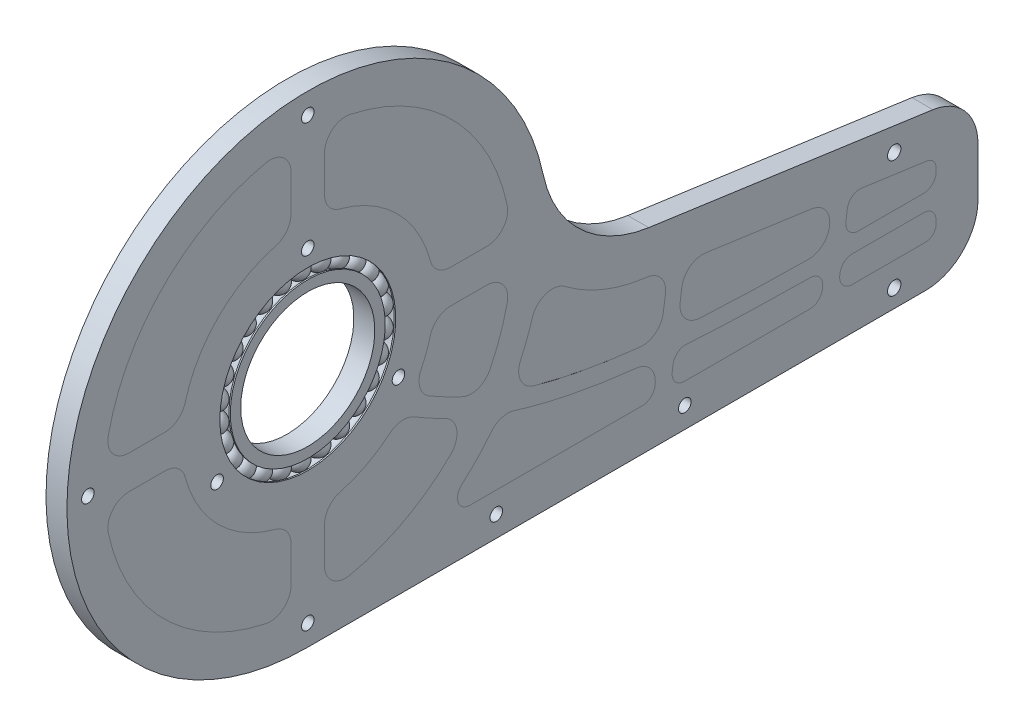
from build123d import *
from OCP.BRepFilletAPI import BRepFilletAPI_MakeFillet

# Parameters (mm, degrees)
SKETCH1_R           = 23.5
SKETCH1_R_2         = 1.5
BOSS_EXTRUDE1_DEPTH = 5
CUT_EXTRUDE1_DEPTH  = 171.091886932
FILLET1_R1          = 5
FILLET1_R2          = 3
BOSS_EXTRUDE2_DEPTH = 5
SKETCH7_R           = 1.6
CUT_EXTRUDE2_DEPTH  = 171.091887063
CIRPATTERN1_COUNT   = 26
SKETCH10_R          = 1.5
CUT_EXTRUDE3_DEPTH  = 171.091887063


# Read off the part's stored shape, not the designer's step: Boss-Extrude2
with BuildPart() as part:
    # Sketch1 → Boss-Extrude1 (new body)
    with BuildSketch(Plane(origin=(0, 0, 0), x_dir=(0, 0, -1), z_dir=(1, 0, 0))):
        with BuildLine():
            Line((0, -57.5), (147.5, -57.5))
            ThreePointArc((147.5, -57.5), (156.338834765, -53.838834765), (160, -45))
            Line((160, -45), (160, -33.365178619))
            ThreePointArc((160, -33.365178619), (156.934208165, -25.164830072), (149.240685392, -20.986971383))
            Line((149.240685392, -20.986971383), (81.395536862, -11.446247371))
            ThreePointArc((81.395536862, -11.446247371), (65.121194516, -3.68658445), (56.233805186, 12.000381425))
            ThreePointArc((56.233805186, 12.000381425), (-44.700514158, 36.16785913), (0, -57.5))
        make_face()
        Circle(SKETCH1_R, mode=Mode.SUBTRACT)
        with Locations((0, 52.5)):
            Circle(SKETCH1_R_2, mode=Mode.SUBTRACT)
        with Locations((-52.5, 0)):
            Circle(SKETCH1_R_2, mode=Mode.SUBTRACT)
        with Locations((0, -52.5)):
            Circle(SKETCH1_R_2, mode=Mode.SUBTRACT)
        with Locations((45, -52.5)):
            Circle(SKETCH1_R_2, mode=Mode.SUBTRACT)
        with Locations((90, -52.5)):
            Circle(SKETCH1_R_2, mode=Mode.SUBTRACT)
    extrude(amount=BOSS_EXTRUDE1_DEPTH)

    # Sketch2 → Cut-Extrude1 (cut, through all)
    with BuildSketch(Plane(origin=(5, 0, 0), x_dir=(0, 0, -1), z_dir=(1, 0, 0))):
        with BuildLine():
            ThreePointArc((22.185246346, -20.586763819), (13.912908948, -26.878075909), (4, -30))
            Line((4, -30), (4, -48.5))
            ThreePointArc((4, -48.5), (23.432821368, -42.651528492), (38.790670249, -29.385947349))
            add(Edge.make_bspline(
                [(38.790670249, -29.385947349), (38.208277868, -29.138826897), (37.04735221, -28.634254689), (33.613250417, -27.069615417), (29.274833218, -24.860974129), (24.928400153, -22.320548454), (22.810244388, -20.988202917), (22.185246346, -20.586763819)],
                knots=[0.667204069, 0.667204069, 0.667204069, 0.667204069, 0.681111736, 0.695019404, 0.75, 0.787250705, 0.802875705, 0.802875705, 0.802875705, 0.802875705], degree=3))
        make_face()
        with BuildLine():
            add(Edge.make_bspline(
                [(41.120637072, -26.025818082), (40.546652129, -25.787609064), (39.402827933, -25.301001665), (35.833175383, -23.706675572), (31.540190896, -21.541218104), (27.246972835, -19.043482716), (25.325200598, -17.84518612), (24.721080246, -17.460475122)],
                knots=[0.660871723, 0.660871723, 0.660871723, 0.660871723, 0.675055768, 0.689239813, 0.75, 0.784024564, 0.799649564, 0.799649564, 0.799649564, 0.799649564], degree=3))
            ThreePointArc((41.120637072, -26.025818082), (46.143784119, -15.45966323), (48.5, -4))
            Line((48.5, -4), (30, -4))
            ThreePointArc((30, -4), (28.176146888, -11.050101654), (24.721080246, -17.460475122))
        make_face()
        with BuildLine():
            Line((30, 4), (48.201922205, 4))
            Line((48.201922205, 4), (48.5, 4))
            ThreePointArc((48.5, 4), (34.41111739, 34.41111739), (4, 48.5))
            Line((4, 48.5), (4, 30))
            ThreePointArc((4, 30), (21.400934559, 21.400934559), (30, 4))
        make_face()
        with BuildLine():
            ThreePointArc((45.879697443, -32.11001966), (38.546027668, -40.622699947), (29.6605799, -47.5))
            Line((29.6605799, -47.5), (82.519678579, -47.5))
            Line((82.519678579, -47.5), (83.638752831, -39.542138653))
            add(Edge.make_bspline(
                [(83.638752831, -39.542138653), (82.136627814, -39.407732053), (74.115556507, -38.620412405), (61.898724071, -36.757253444), (51.310285462, -33.943549975), (46.479451728, -32.317463696), (45.879697443, -32.11001966)],
                knots=[0.346672188, 0.346672188, 0.346672188, 0.346672188, 0.375, 0.5, 0.597665733, 0.6115734, 0.6115734, 0.6115734, 0.6115734], degree=3))
        make_face()
        with BuildLine():
            Line((87.5930026, -39.867473629), (86.519678579, -47.5))
            Line((86.519678579, -47.5), (122.480321421, -47.5))
            Line((122.480321421, -47.5), (123.379214774, -41.107869489))
            add(Edge.make_bspline(
                [(123.379214774, -41.107869489), (123.309909416, -41.107243691), (119.069012377, -41.068607323), (110.949562787, -40.952647021), (99.651727414, -40.60714539), (92.047864376, -40.193028013), (88.114578612, -39.906787388), (87.5930026, -39.867473629)],
                knots=[0.123962248, 0.123962248, 0.123962248, 0.123962248, 0.125, 0.1875, 0.25, 0.3125, 0.322106441, 0.322106441, 0.322106441, 0.322106441], degree=3))
        make_face()
        with BuildLine():
            add(Edge.make_bspline(
                [(84.196491813, -35.575994784), (82.647837316, -35.438625592), (74.684695363, -34.660281607), (63.048861545, -32.88222555), (53.085222246, -30.275299461), (48.711109914, -28.846362296), (48.118024667, -28.647088894)],
                knots=[0.345388461, 0.345388461, 0.345388461, 0.345388461, 0.375, 0.5, 0.589951496, 0.604135542, 0.604135542, 0.604135542, 0.604135542], degree=3))
            Line((84.196491813, -35.575994784), (86.077071858, -22.202981125))
            Line((86.077071858, -22.202981125), (80.002988548, -21.34881316))
            ThreePointArc((80.002988548, -21.34881316), (66.51040029, -16.904021152), (55.422178193, -8.023849723))
            ThreePointArc((55.422178193, -8.023849723), (52.787052395, -18.695643863), (48.118024667, -28.647088894))
        make_face()
        with BuildLine():
            Line((89.999504226, -22.754573177), (88.151196988, -35.898091313))
            add(Edge.make_bspline(
                [(123.94103929, -37.112672931), (123.696247868, -37.110561437), (119.287195408, -37.071300928), (111.033523944, -36.953360628), (99.8147399, -36.610105812), (92.380317535, -36.205001573), (88.580803362, -35.930099221), (88.151196988, -35.898091313)],
                knots=[0.121334068, 0.121334068, 0.121334068, 0.121334068, 0.125, 0.1875, 0.25, 0.3125, 0.320505317, 0.320505317, 0.320505317, 0.320505317], degree=3))
            Line((123.94103929, -37.112672931), (125.262801588, -27.713474368))
            Line((125.262801588, -27.713474368), (89.999504226, -22.754573177))
        make_face()
        with BuildLine():
            Line((127.414275447, -41.138422271), (126.519678579, -47.5))
            Line((126.519678579, -47.5), (147.5, -47.5))
            ThreePointArc((147.5, -47.5), (149.267766953, -46.767766953), (150, -45))
            Line((150, -45), (150, -41.182589309))
            add(Edge.make_bspline(
                [(150, -41.182589309), (148.812824417, -41.182589309), (146.423466184, -41.182589324), (141.76480628, -41.181393352), (136.080016811, -41.17541248), (130.968491752, -41.158687842), (128.116800073, -41.142792862), (127.414275447, -41.138422271)],
                knots=[0, 0, 0, 0, 0.015625, 0.03125, 0.0625, 0.09375, 0.104041802, 0.104041802, 0.104041802, 0.104041802], degree=3))
        make_face()
        with BuildLine():
            Line((129.223827903, -28.270493694), (127.976307043, -37.141753144))
            add(Edge.make_bspline(
                [(150, -37.182589309), (148.812993791, -37.182589309), (146.423722347, -37.182589295), (141.767251686, -37.181393752), (136.087757115, -37.175417046), (131.169092842, -37.159320148), (128.499860489, -37.144838913), (127.976307043, -37.141753144)],
                knots=[0, 0, 0, 0, 0.015625, 0.03125, 0.0625, 0.09375, 0.101416179, 0.101416179, 0.101416179, 0.101416179], degree=3))
            Line((150, -37.182589309), (150, -33.365178619))
            ThreePointArc((150, -33.365178619), (149.386841633, -31.725108909), (147.848137078, -30.889537172))
            Line((147.848137078, -30.889537172), (129.223827903, -28.270493694))
        make_face()
        with BuildLine():
            ThreePointArc((-4, -30), (-21.400934559, -21.400934559), (-30, -4))
            Line((-30, -4), (-48.5, -4))
            ThreePointArc((-48.5, -4), (-34.41111739, -34.41111739), (-4, -48.5))
            Line((-4, -48.5), (-4, -30))
        make_face()
        with BuildLine():
            ThreePointArc((-30, 4), (-21.400934559, 21.400934559), (-4, 30))
            Line((-4, 30), (-4, 48.5))
            ThreePointArc((-4, 48.5), (-34.41111739, 34.41111739), (-48.5, 4))
            Line((-48.5, 4), (-30, 4))
        make_face()
    extrude(amount=-CUT_EXTRUDE1_DEPTH, mode=Mode.SUBTRACT)

    # Fillet1: one fillet with a radius per group of edges: ONE call of the kernel's fillet builder (fillet() takes one radius for all edges)
    fillet1_edges_1 = [part.edges().sort_by_distance(p)[0] for p in [
        (2.5, 48.5, 4),
        (2.5, 4, 48.5),
        (2.5, 4, 30),
        (2.5, 30, 4),
        (2.5, 48.5, -4),
        (2.5, 30, -4),
        (2.5, 4, -48.5),
        (2.5, 4, -30),
        (2.5, -4, -30),
        (2.5, -4, -48.5),
        (2.5, -4, 48.5),
        (2.5, -4, 30),
        (2.5, -30, 4),
        (2.5, -29.385947349, -38.790670249),
        (2.5, -20.586763819, -22.185246346),
        (2.5, -48.5, -4),
        (2.5, -48.5, 4),
        (2.5, -32.11001966, -45.879697443),
        (2.5, -8.023849723, -55.422178193),
        (2.5, -22.202981125, -86.077071858),
        (2.5, -28.647088894, -48.118024667),
        (2.5, -35.575994784, -84.196491813),
        (2.5, -35.898091313, -88.151196988),
        (2.5, -27.713474368, -125.262801588),
        (2.5, -37.112672931, -123.94103929),
        (2.5, -22.754573177, -89.999504226),
        (2.5, -39.542138653, -83.638752831),
        (2.5, -30, -4),
        (2.5, -17.460475122, -24.721080246),
        (2.5, -26.025818082, -41.120637072),
    ]]
    fillet1_edges_2 = [part.edges().sort_by_distance(p)[0] for p in [
        (2.5, -47.5, -29.6605799),
        (2.5, -47.5, -82.519678579),
        (2.5, -39.867473629, -87.5930026),
        (2.5, -47.5, -86.519678579),
        (2.5, -41.107869489, -123.379214774),
        (2.5, -47.5, -122.480321421),
        (2.5, -41.138422271, -127.414275447),
        (2.5, -47.5, -126.519678579),
        (2.5, -28.270493694, -129.223827903),
        (2.5, -37.141753144, -127.976307043),
        (2.5, -37.182589309, -150),
        (2.5, -41.182589309, -150),
    ]]
    fillet1 = BRepFilletAPI_MakeFillet(part.part.solid().wrapped)
    for e in fillet1_edges_1:
        fillet1.Add(FILLET1_R1, e.wrapped)
    for e in fillet1_edges_2:
        fillet1.Add(FILLET1_R2, e.wrapped)
    add(Compound.cast(fillet1.Shape()), mode=Mode.REPLACE)

    # Sketch7 → Cut-Extrude2 (cut, through all)
    with BuildSketch(Plane(origin=(5, 0, 0), x_dir=(0, 0, -1), z_dir=(1, 0, 0))):
        with Locations((140, -25.182589309)):
            Circle(SKETCH7_R)
        with Locations(Location((140, -53.182589309, 0), (0, 0, 180))):
            Circle(SKETCH7_R)
    extrude(amount=-CUT_EXTRUDE2_DEPTH, mode=Mode.SUBTRACT)

    # Sketch4 → Revolve3 (revolve)
    with BuildSketch(Plane.XY, mode=Mode.PRIVATE) as revolve3_sk:
        with BuildLine():
            ThreePointArc((0.334936491, 18.5), (2.5, 17.25), (4.665063509, 18.5))
            Line((4.665063509, 18.5), (5, 18.5))
            Line((5, 18.5), (5, 16))
            Line((5, 16), (0, 16))
            Line((0, 16), (0, 18.5))
            Line((0, 18.5), (0.334936491, 18.5))
        make_face()
        with BuildLine():
            ThreePointArc((4.665063509, 21), (2.5, 22.25), (0.334936491, 21))
            Line((0.334936491, 21), (0, 21))
            Line((0, 21), (0, 23.5))
            Line((0, 23.5), (5, 23.5))
            Line((5, 23.5), (5, 21))
            Line((5, 21), (4.665063509, 21))
        make_face()
    revolve(revolve3_sk.sketch.rotate(Axis((0, 0, 0), (1, 0, 0)), 90), axis=Axis((0, 0, 0), (1, 0, 0)))


with BuildPart() as body_2:
    # Boss-Extrude2 outline → Boss-Extrude2 (new body)
    with BuildSketch(Plane(origin=(0, 0, 0), x_dir=(0, 0, -1), z_dir=(1, 0, 0))):
        with BuildLine():
            ThreePointArc((127.000301711, -44.082235506), (127.706861488, -46.468083651), (129.971071448, -47.5))
            Line((129.971071448, -47.5), (147.5, -47.5))
            ThreePointArc((147.5, -47.5), (149.267766953, -46.767766953), (150, -45))
            Line((150, -45), (150, -44.182500207))
            ThreePointArc((150, -44.182500207), (149.121415194, -42.061274718), (147.000268283, -41.182500219))
            add(Edge.make_bspline(
                [(147.000268283, -41.182500219), (146.812686203, -41.182483444), (145.443341439, -41.182337706), (141.76480628, -41.181393352), (136.255555018, -41.175597161), (132.030232477, -41.162146761), (130.034095757, -41.152710267)],
                knots=[0.013149231, 0.013149231, 0.013149231, 0.013149231, 0.015625, 0.03125, 0.0625, 0.091337611, 0.091337611, 0.091337611, 0.091337611], degree=3))
            ThreePointArc((130.034095757, -41.152710267), (128.057187471, -41.883821212), (127.049144044, -43.734912251))
            Line((127.049144044, -43.734912251), (127.000301711, -44.082235506))
        make_face()
        with BuildLine():
            Line((89.971071448, -47.5), (119.872678552, -47.5))
            ThreePointArc((119.872678552, -47.5), (121.840762204, -46.76420996), (122.843448289, -44.917764494))
            Line((122.843448289, -44.917764494), (122.903627951, -44.489820231))
            ThreePointArc((122.903627951, -44.489820231), (122.208769003, -42.117514849), (119.968652158, -41.072269279))
            add(Edge.make_bspline(
                [(119.968652158, -41.072269279), (116.930598371, -41.036018723), (109.976696211, -40.922895571), (100.092777534, -40.620633242), (93.419117385, -40.267091683), (90.372954412, -40.064496339)],
                knots=[0.14114579, 0.14114579, 0.14114579, 0.14114579, 0.1875, 0.25, 0.305180288, 0.305180288, 0.305180288, 0.305180288], degree=3))
            ThreePointArc((90.372954412, -40.064496339), (88.282040284, -40.729582629), (87.203099383, -42.64011873))
            Line((87.203099383, -42.64011873), (87.000301711, -44.082235506))
            ThreePointArc((87.000301711, -44.082235506), (87.706861488, -46.468083651), (89.971071448, -47.5))
        make_face()
        with BuildLine():
            Line((38.73951471, -47.5), (79.91203571, -47.5))
            ThreePointArc((79.91203571, -47.5), (81.880119362, -46.76420996), (82.882805447, -44.917764494))
            Line((82.882805447, -44.917764494), (82.913898967, -44.696655021))
            ThreePointArc((82.913898967, -44.696655021), (81.911175874, -40.932991828), (78.51236968, -39.030695665))
            add(Edge.make_bspline(
                [(78.51236968, -39.030695665), (72.309256976, -38.344498563), (62.27249356, -36.793159127), (52.985980437, -34.385427724), (49.222984389, -33.209816183)],
                knots=[0.379394701, 0.379394701, 0.379394701, 0.379394701, 0.5, 0.585926939, 0.585926939, 0.585926939, 0.585926939], degree=3))
            ThreePointArc((49.222984389, -33.209816183), (46.264295939, -33.202595877), (43.819526871, -34.869027299))
            ThreePointArc((43.819526871, -34.869027299), (40.46268709, -38.713963287), (36.769708878, -42.237288136))
            ThreePointArc((36.769708878, -42.237288136), (35.929876336, -45.551633112), (38.73951471, -47.5))
        make_face()
        with BuildLine():
            Line((150, -34.182500163), (150, -33.365178619))
            ThreePointArc((150, -33.365178619), (149.386841633, -31.725108909), (147.848137078, -30.889537172))
            Line((147.848137078, -30.889537172), (132.19459764, -28.688258188))
            ThreePointArc((132.19459764, -28.688258188), (129.971585827, -29.262972392), (128.806063409, -31.24126343))
            Line((128.806063409, -31.24126343), (128.454541654, -33.74097369))
            ThreePointArc((128.454541654, -33.74097369), (129.157125744, -36.122238598), (131.413176817, -37.158713643))
            add(Edge.make_bspline(
                [(131.413176817, -37.158713643), (132.964881549, -37.164990119), (136.738536803, -37.176101881), (141.767251686, -37.181393752), (145.443755956, -37.18233769), (146.812493402, -37.182483398), (146.999731573, -37.182500151)],
                knots=[0.013153288, 0.013153288, 0.013153288, 0.013153288, 0.035451406, 0.066701406, 0.082326406, 0.084798118, 0.084798118, 0.084798118, 0.084798118], degree=3))
            ThreePointArc((146.999731573, -37.182500151), (149.121225438, -36.303915408), (150, -34.182500163))
        make_face()
        with BuildLine():
            Line((124.552654082, -32.763412189), (124.566527431, -32.664757263))
            ThreePointArc((124.566527431, -32.664757263), (123.608670425, -28.959737573), (120.311518694, -27.017200211))
            Line((120.311518694, -27.017200211), (94.95078712, -23.450847334))
            ThreePointArc((94.95078712, -23.450847334), (91.245767431, -24.40870434), (89.303230069, -27.705856071))
            Line((89.303230069, -27.705856071), (88.900856811, -30.567177017))
            ThreePointArc((88.900856811, -30.567177017), (89.985118561, -34.433016992), (93.562888485, -36.255077535))
            add(Edge.make_bspline(
                [(93.562888485, -36.255077535), (95.645334652, -36.375749647), (101.312204101, -36.655922881), (109.9215952, -36.91933957), (116.679734901, -37.031346079), (119.539466767, -37.066754802)],
                knots=[0.143583711, 0.143583711, 0.143583711, 0.143583711, 0.18105653, 0.24355653, 0.287472819, 0.287472819, 0.287472819, 0.287472819], degree=3))
            ThreePointArc((119.539466767, -37.066754802), (122.858086538, -35.86105489), (124.552654082, -32.763412189))
        make_face()
        with BuildLine():
            Line((81.125788964, -21.506706968), (80.002988548, -21.34881316))
            ThreePointArc((80.002988548, -21.34881316), (70.218668397, -18.674155024), (61.421707918, -13.624382426))
            ThreePointArc((61.421707918, -13.624382426), (56.854417413, -12.85589305), (53.615661085, -16.166659718))
            ThreePointArc((53.615661085, -16.166659718), (52.345035582, -19.899679643), (50.814856037, -23.534026557))
            ThreePointArc((50.814856037, -23.534026557), (50.813374255, -27.733328861), (54.013210489, -30.452738745))
            add(Edge.make_bspline(
                [(54.013210489, -30.452738745), (56.511617504, -31.147001548), (64.503556907, -33.097971644), (73.121226203, -34.421311833), (79.372600536, -35.101053847)],
                knots=[0.376625329, 0.376625329, 0.376625329, 0.376625329, 0.43449557, 0.557870241, 0.557870241, 0.557870241, 0.557870241], degree=3))
            ThreePointArc((79.372600536, -35.101053847), (82.98415693, -34.076051454), (84.864371713, -30.826626603))
            Line((84.864371713, -30.826626603), (85.380797701, -27.154264019))
            ThreePointArc((85.380797701, -27.154264019), (84.422940695, -23.44924433), (81.125788964, -21.506706968))
        make_face()
        with BuildLine():
            ThreePointArc((-47.61971687, -10.0305815), (-34.41111739, -34.41111739), (-10.0305815, -47.61971687))
            ThreePointArc((-10.0305815, -47.61971687), (-5.849833933, -46.609920301), (-4, -42.727079363))
            Line((-4, -42.727079363), (-4, -34.097726009))
            ThreePointArc((-4, -34.097726009), (-5.038928508, -31.046511064), (-7.723965056, -29.263293797))
            ThreePointArc((-7.723965056, -29.263293797), (-21.400934559, -21.400934559), (-29.263293797, -7.723965056))
            ThreePointArc((-29.263293797, -7.723965056), (-31.046511064, -5.038928508), (-34.097726009, -4))
            Line((-34.097726009, -4), (-42.727079363, -4))
            ThreePointArc((-42.727079363, -4), (-46.609920301, -5.849833933), (-47.61971687, -10.0305815))
        make_face()
        with BuildLine():
            ThreePointArc((10.0305815, -47.61971687), (23.006224156, -42.883139461), (34.128327556, -34.691602129))
            ThreePointArc((34.128327556, -34.691602129), (35.559721465, -30.341494752), (32.848768838, -26.650551976))
            add(Edge.make_bspline(
                [(32.848768838, -26.650551976), (31.413241176, -25.936452988), (28.92150774, -24.62767543), (26.453145204, -23.207625264), (25.400791824, -22.579226637)],
                knots=[0.715007628, 0.715007628, 0.715007628, 0.715007628, 0.75, 0.776154556, 0.776154556, 0.776154556, 0.776154556], degree=3))
            ThreePointArc((25.400791824, -22.579226637), (22.422590157, -21.889337831), (19.599438982, -23.062133284))
            ThreePointArc((19.599438982, -23.062133284), (14.009129165, -26.828050619), (7.723965056, -29.263293797))
            ThreePointArc((7.723965056, -29.263293797), (5.038928508, -31.046511064), (4, -34.097726009))
            Line((4, -34.097726009), (4, -42.727079363))
            ThreePointArc((4, -42.727079363), (5.849833933, -46.609920301), (10.0305815, -47.61971687))
        make_face()
        with BuildLine():
            ThreePointArc((43.470458548, -21.876225306), (45.928584059, -16.087733411), (47.61971687, -10.0305815))
            ThreePointArc((47.61971687, -10.0305815), (46.609920301, -5.849833933), (42.727079363, -4))
            Line((42.727079363, -4), (34.097726009, -4))
            ThreePointArc((34.097726009, -4), (31.046511064, -5.038928508), (29.263293797, -7.723965056))
            ThreePointArc((29.263293797, -7.723965056), (28.319488967, -10.67738473), (27.078470008, -13.51874484))
            ThreePointArc((27.078470008, -13.51874484), (26.765470141, -17.197622518), (29.062468052, -20.088281696))
            add(Edge.make_bspline(
                [(29.062468052, -20.088281696), (29.543171425, -20.364263669), (32.128533422, -21.8221752), (34.737633759, -23.15259074), (36.885206954, -24.157389595)],
                knots=[0.696055038, 0.696055038, 0.696055038, 0.696055038, 0.708398801, 0.762343763, 0.762343763, 0.762343763, 0.762343763], degree=3))
            ThreePointArc((36.885206954, -24.157389595), (40.640744743, -24.353139054), (43.470458548, -21.876225306))
        make_face()
        with BuildLine():
            ThreePointArc((47.61971687, 10.0305815), (34.41111739, 34.41111739), (10.0305815, 47.61971687))
            ThreePointArc((10.0305815, 47.61971687), (5.849833933, 46.609920301), (4, 42.727079363))
            Line((4, 42.727079363), (4, 34.097726009))
            ThreePointArc((4, 34.097726009), (5.038928508, 31.046511064), (7.723965056, 29.263293797))
            ThreePointArc((7.723965056, 29.263293797), (21.400934559, 21.400934559), (29.263293797, 7.723965056))
            ThreePointArc((29.263293797, 7.723965056), (31.046511064, 5.038928508), (34.097726009, 4))
            Line((34.097726009, 4), (42.727079363, 4))
            ThreePointArc((42.727079363, 4), (46.609920301, 5.849833933), (47.61971687, 10.0305815))
        make_face()
        with BuildLine():
            ThreePointArc((-10.0305815, 47.61971687), (-34.41111739, 34.41111739), (-47.61971687, 10.0305815))
            ThreePointArc((-47.61971687, 10.0305815), (-46.609920301, 5.849833933), (-42.727079363, 4))
            Line((-42.727079363, 4), (-34.097726009, 4))
            ThreePointArc((-34.097726009, 4), (-31.046511064, 5.038928508), (-29.263293797, 7.723965056))
            ThreePointArc((-29.263293797, 7.723965056), (-21.400934559, 21.400934559), (-7.723965056, 29.263293797))
            ThreePointArc((-7.723965056, 29.263293797), (-5.038928508, 31.046511064), (-4, 34.097726009))
            Line((-4, 34.097726009), (-4, 42.727079363))
            ThreePointArc((-4, 42.727079363), (-5.849833933, 46.609920301), (-10.0305815, 47.61971687))
        make_face()
    extrude(amount=BOSS_EXTRUDE2_DEPTH)


with BuildPart() as revolve3_piece_1:
    # of the separate pieces the step leaves, piece 1, a body of its own (revolve3_pieces)
    add(part.part.solids().sort_by_distance((0, -57.5, 0))[0])

    # Sketch10 → Cut-Extrude3 (cut, through all)
    with BuildSketch(Plane(origin=(5, 0, 0), x_dir=(0, 0, -1), z_dir=(1, 0, 0))):
        with Locations((0, 25)):
            Circle(SKETCH10_R)
        with Locations((21.650635095, -12.5)):
            Circle(SKETCH10_R)
        with Locations((-21.650635095, -12.5)):
            Circle(SKETCH10_R)
    extrude(amount=-CUT_EXTRUDE3_DEPTH, mode=Mode.SUBTRACT)


with BuildPart() as revolve3_piece_2:
    # of the separate pieces the step leaves, piece 2, a body of its own (revolve3_pieces)
    add(part.part.solids().sort_by_distance((0.334936491, 0, 18.5))[0])


with BuildPart() as body_4:
    # Sketch5 → Revolve9 (revolve)
    with BuildSketch(Plane.XY):
        with BuildLine():
            Line((4.85, 19.75), (0.15, 19.75))
            ThreePointArc((0.15, 19.75), (2.5, 17.4), (4.85, 19.75))
        make_face()
    revolve(axis=Axis((2.5, 19.75, 0), (1, 0, 0)))


with BuildPart() as cirpattern1_1:
    # CirPattern1: pattern copy
    add(body_4.part.rotate(Axis((0, 0, 0), (1, 0, 0)), 1 * 360 / CIRPATTERN1_COUNT))


with BuildPart() as cirpattern1_2:
    # CirPattern1: pattern copy
    add(body_4.part.rotate(Axis((0, 0, 0), (1, 0, 0)), 2 * 360 / CIRPATTERN1_COUNT))


with BuildPart() as cirpattern1_3:
    # CirPattern1: pattern copy
    add(body_4.part.rotate(Axis((0, 0, 0), (1, 0, 0)), 3 * 360 / CIRPATTERN1_COUNT))


with BuildPart() as cirpattern1_4:
    # CirPattern1: pattern copy
    add(body_4.part.rotate(Axis((0, 0, 0), (1, 0, 0)), 4 * 360 / CIRPATTERN1_COUNT))


with BuildPart() as cirpattern1_5:
    # CirPattern1: pattern copy
    add(body_4.part.rotate(Axis((0, 0, 0), (1, 0, 0)), 5 * 360 / CIRPATTERN1_COUNT))


with BuildPart() as cirpattern1_6:
    # CirPattern1: pattern copy
    add(body_4.part.rotate(Axis((0, 0, 0), (1, 0, 0)), 6 * 360 / CIRPATTERN1_COUNT))


with BuildPart() as cirpattern1_7:
    # CirPattern1: pattern copy
    add(body_4.part.rotate(Axis((0, 0, 0), (1, 0, 0)), 7 * 360 / CIRPATTERN1_COUNT))


with BuildPart() as cirpattern1_8:
    # CirPattern1: pattern copy
    add(body_4.part.rotate(Axis((0, 0, 0), (1, 0, 0)), 8 * 360 / CIRPATTERN1_COUNT))


with BuildPart() as cirpattern1_9:
    # CirPattern1: pattern copy
    add(body_4.part.rotate(Axis((0, 0, 0), (1, 0, 0)), 9 * 360 / CIRPATTERN1_COUNT))


with BuildPart() as cirpattern1_10:
    # CirPattern1: pattern copy
    add(body_4.part.rotate(Axis((0, 0, 0), (1, 0, 0)), 10 * 360 / CIRPATTERN1_COUNT))


with BuildPart() as cirpattern1_11:
    # CirPattern1: pattern copy
    add(body_4.part.rotate(Axis((0, 0, 0), (1, 0, 0)), 11 * 360 / CIRPATTERN1_COUNT))


with BuildPart() as cirpattern1_12:
    # CirPattern1: pattern copy
    add(body_4.part.rotate(Axis((0, 0, 0), (1, 0, 0)), 12 * 360 / CIRPATTERN1_COUNT))


with BuildPart() as cirpattern1_13:
    # CirPattern1: pattern copy
    add(body_4.part.rotate(Axis((0, 0, 0), (1, 0, 0)), 13 * 360 / CIRPATTERN1_COUNT))


with BuildPart() as cirpattern1_14:
    # CirPattern1: pattern copy
    add(body_4.part.rotate(Axis((0, 0, 0), (1, 0, 0)), 14 * 360 / CIRPATTERN1_COUNT))


with BuildPart() as cirpattern1_15:
    # CirPattern1: pattern copy
    add(body_4.part.rotate(Axis((0, 0, 0), (1, 0, 0)), 15 * 360 / CIRPATTERN1_COUNT))


with BuildPart() as cirpattern1_16:
    # CirPattern1: pattern copy
    add(body_4.part.rotate(Axis((0, 0, 0), (1, 0, 0)), 16 * 360 / CIRPATTERN1_COUNT))


with BuildPart() as cirpattern1_17:
    # CirPattern1: pattern copy
    add(body_4.part.rotate(Axis((0, 0, 0), (1, 0, 0)), 17 * 360 / CIRPATTERN1_COUNT))


with BuildPart() as cirpattern1_18:
    # CirPattern1: pattern copy
    add(body_4.part.rotate(Axis((0, 0, 0), (1, 0, 0)), 18 * 360 / CIRPATTERN1_COUNT))


with BuildPart() as cirpattern1_19:
    # CirPattern1: pattern copy
    add(body_4.part.rotate(Axis((0, 0, 0), (1, 0, 0)), 19 * 360 / CIRPATTERN1_COUNT))


with BuildPart() as cirpattern1_20:
    # CirPattern1: pattern copy
    add(body_4.part.rotate(Axis((0, 0, 0), (1, 0, 0)), 20 * 360 / CIRPATTERN1_COUNT))


with BuildPart() as cirpattern1_21:
    # CirPattern1: pattern copy
    add(body_4.part.rotate(Axis((0, 0, 0), (1, 0, 0)), 21 * 360 / CIRPATTERN1_COUNT))


with BuildPart() as cirpattern1_22:
    # CirPattern1: pattern copy
    add(body_4.part.rotate(Axis((0, 0, 0), (1, 0, 0)), 22 * 360 / CIRPATTERN1_COUNT))


with BuildPart() as cirpattern1_23:
    # CirPattern1: pattern copy
    add(body_4.part.rotate(Axis((0, 0, 0), (1, 0, 0)), 23 * 360 / CIRPATTERN1_COUNT))


with BuildPart() as cirpattern1_24:
    # CirPattern1: pattern copy
    add(body_4.part.rotate(Axis((0, 0, 0), (1, 0, 0)), 24 * 360 / CIRPATTERN1_COUNT))


with BuildPart() as cirpattern1_25:
    # CirPattern1: pattern copy
    add(body_4.part.rotate(Axis((0, 0, 0), (1, 0, 0)), 25 * 360 / CIRPATTERN1_COUNT))


solid = Compound([body_2.part, revolve3_piece_1.part, revolve3_piece_2.part, body_4.part, cirpattern1_1.part, cirpattern1_2.part, cirpattern1_3.part, cirpattern1_4.part, cirpattern1_5.part, cirpattern1_6.part, cirpattern1_7.part, cirpattern1_8.part, cirpattern1_9.part, cirpattern1_10.part, cirpattern1_11.part, cirpattern1_12.part, cirpattern1_13.part, cirpattern1_14.part, cirpattern1_15.part, cirpattern1_16.part, cirpattern1_17.part, cirpattern1_18.part, cirpattern1_19.part, cirpattern1_20.part, cirpattern1_21.part, cirpattern1_22.part, cirpattern1_23.part, cirpattern1_24.part, cirpattern1_25.part])
